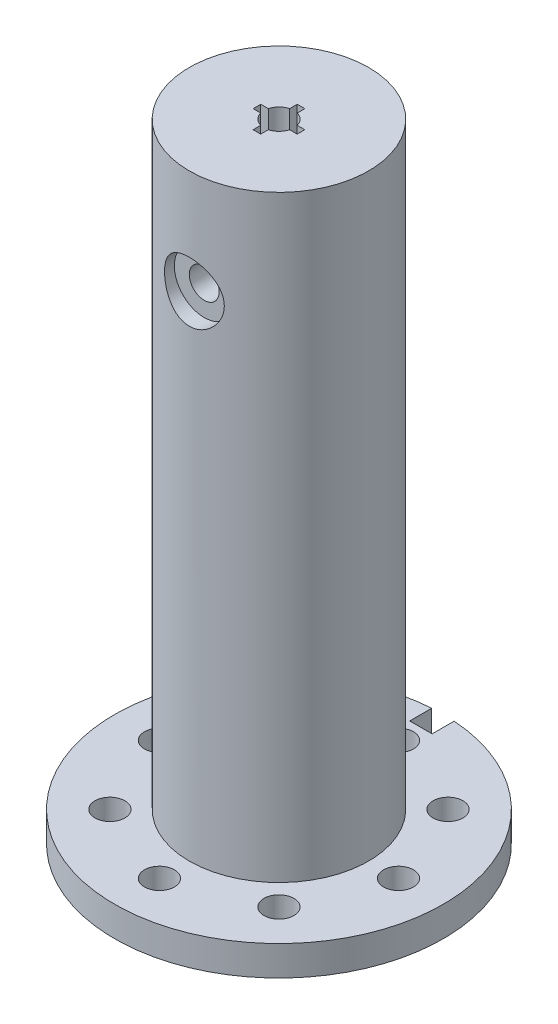
from build123d import *

# Parameters (mm, degrees)
SKETCH1_R               = 11
SKETCH1_R_2             = 1
BOSS_EXTRUDE1_DEPTH     = 2
SKETCH2_R               = 4
CUT_EXTRUDE1_DEPTH      = 16.684387141
SKETCH4_W               = 1.5
SKETCH4_H               = 3
CUT_EXTRUDE3_DEPTH      = 4
BOSS_EXTRUDE2_START     = 20
SKETCH5_R               = 6
SKETCH5_R_2             = 4
BOSS_EXTRUDE2_DEPTH     = 20
BOSS_EXTRUDE3_START     = 20
SKETCH6_R               = 6
BOSS_EXTRUDE3_DEPTH     = 20
CUT_EXTRUDE4_DEPTH      = 5
CUT_EXTRUDE4_DEPTH_BACK = 1
SKETCH7_R               = 1
SKETCH8_R               = 2
CUT_EXTRUDE5_DEPTH      = 1


with BuildPart() as part:
    # Sketch1 → Boss-Extrude1 (new body)
    with BuildSketch(Plane(origin=(0, 0, 0), x_dir=(1, 0, 0), z_dir=(0, 1, 0))):
        Circle(SKETCH1_R)
        with Locations((0, 8)):
            Circle(SKETCH1_R_2, mode=Mode.SUBTRACT)
        with Locations((5.656854249, 5.656854249)):
            Circle(SKETCH1_R_2, mode=Mode.SUBTRACT)
        with Locations((8, 0)):
            Circle(SKETCH1_R_2, mode=Mode.SUBTRACT)
        with Locations((5.656854249, -5.656854249)):
            Circle(SKETCH1_R_2, mode=Mode.SUBTRACT)
        with Locations((0, -8)):
            Circle(SKETCH1_R_2, mode=Mode.SUBTRACT)
        with Locations((-5.656854249, -5.656854249)):
            Circle(SKETCH1_R_2, mode=Mode.SUBTRACT)
        with Locations((-8, 0)):
            Circle(SKETCH1_R_2, mode=Mode.SUBTRACT)
        with Locations((-5.656854249, 5.656854249)):
            Circle(SKETCH1_R_2, mode=Mode.SUBTRACT)
    extrude(amount=BOSS_EXTRUDE1_DEPTH)

    # Sketch2 → Cut-Extrude1 (cut, through all)
    with BuildSketch(Plane(origin=(0, 2, 0), x_dir=(1, 0, 0), z_dir=(0, 1, 0))):
        Circle(SKETCH2_R)
    extrude(amount=-CUT_EXTRUDE1_DEPTH, mode=Mode.SUBTRACT)

    # Sketch4 → Cut-Extrude3 (cut)
    with BuildSketch(Plane(origin=(0, 2, 0), x_dir=(1, 0, 0), z_dir=(0, 1, 0))):
        with Locations((0, 11)):
            Rectangle(SKETCH4_W, SKETCH4_H)
    extrude(amount=-CUT_EXTRUDE3_DEPTH, mode=Mode.SUBTRACT)

    # Sketch5 → Boss-Extrude2 (add)
    with BuildSketch(Plane(origin=(0, 2, 0), x_dir=(1, 0, 0), z_dir=(0, 1, 0)).offset(BOSS_EXTRUDE2_START)):
        Circle(SKETCH5_R)
        Circle(SKETCH5_R_2, mode=Mode.SUBTRACT)
    extrude(amount=-BOSS_EXTRUDE2_DEPTH)

    # Sketch6 → Boss-Extrude3 (add)
    with BuildSketch(Plane(origin=(0, 22, 0), x_dir=(1, 0, 0), z_dir=(0, 1, 0)).offset(BOSS_EXTRUDE3_START)):
        Circle(SKETCH6_R)
        with BuildLine():
            ThreePointArc((-0.967204218, 0.254), (-0.707472278, 0.706741095), (-0.255, 0.966941053))
            Line((-0.255, 0.966941053), (-0.255, 1.476941053))
            Line((-0.255, 1.476941053), (0.255, 1.476941053))
            Line((0.255, 1.476941053), (0.255, 0.966941053))
            ThreePointArc((0.255, 0.966941053), (0.707472278, 0.706741095), (0.967204218, 0.254))
            Line((0.967204218, 0.254), (1.475204218, 0.254))
            Line((1.475204218, 0.254), (1.475204218, -0.254))
            Line((1.475204218, -0.254), (0.967204218, -0.254))
            ThreePointArc((0.967204218, -0.254), (0.707106781, -0.707106781), (0.254, -0.967204218))
            Line((0.254, -0.967204218), (0.254, -1.475204218))
            Line((0.254, -1.475204218), (-0.254, -1.475204218))
            Line((-0.254, -1.475204218), (-0.254, -0.967204218))
            ThreePointArc((-0.254, -0.967204218), (-0.707106781, -0.707106781), (-0.967204218, -0.254))
            Line((-0.967204218, -0.254), (-1.475204218, -0.254))
            Line((-1.475204218, -0.254), (-1.475204218, 0.254))
            Line((-1.475204218, 0.254), (-0.967204218, 0.254))
        make_face(mode=Mode.SUBTRACT)
    extrude(amount=-BOSS_EXTRUDE3_DEPTH)

    # Sketch7 → Cut-Extrude4 (cut, two sides: drawn at the far end of the back side and taken through both)
    with BuildSketch(Plane.XY.offset(-CUT_EXTRUDE4_DEPTH_BACK)):
        with Locations((0, 35)):
            Circle(SKETCH7_R)
    extrude(amount=CUT_EXTRUDE4_DEPTH + CUT_EXTRUDE4_DEPTH_BACK, mode=Mode.SUBTRACT)

    # Sketch8 → Cut-Extrude5 (cut)
    with BuildSketch(Plane.XY.offset(6)):
        with Locations((0, 35)):
            Circle(SKETCH8_R)
    extrude(amount=-CUT_EXTRUDE5_DEPTH, mode=Mode.SUBTRACT)


solid = part.part
